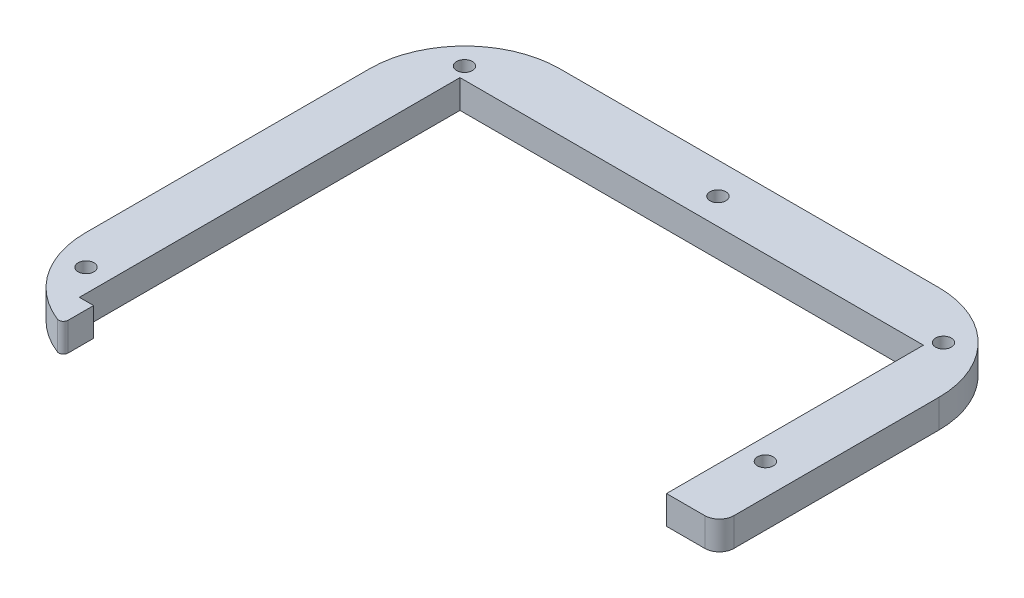
from build123d import *

# Parameters (mm, degrees)
BOSS_EXTRUDE1_DEPTH    = 6
CUT_EXTRUDE1_DEPTH     = 79.33262411
SKETCH3_W              = 25
SKETCH3_H              = 31.620571099
CUT_EXTRUDE2_DEPTH     = 79.33262411
FILLET1_R              = 3
SKETCH4_R              = 1.75
CUT_EXTRUDE3_DEPTH     = 79.33262411
MOVE_FACE1_OUTLINE_R   = 1.75
MOVE_FACE1_OUTLINE_R_2 = 1.67
MOVE_FACE1_DEPTH       = 6
FILLET2_R              = 1


# Read off the part's stored shape, not the designer's step: Move Face1
with BuildPart() as part:
    # Sketch1 → Boss-Extrude1 (new body)
    with BuildSketch(Plane(origin=(0, 0, 0), x_dir=(1, 0, 0), z_dir=(0, 1, 0))):
        with BuildLine():
            Line((-60, 30), (-60, -30))
            ThreePointArc((-60, -30), (-54.142135624, -44.142135624), (-40, -50))
            Line((-40, -50), (40, -50))
            ThreePointArc((40, -50), (54.142135624, -44.142135624), (60, -30))
            Line((60, -30), (60, 30))
            ThreePointArc((60, 30), (54.142135624, 44.142135624), (40, 50))
            Line((40, 50), (-40, 50))
            ThreePointArc((-40, 50), (-54.142135624, 44.142135624), (-60, 30))
        make_face()
    extrude(amount=BOSS_EXTRUDE1_DEPTH)

    # Sketch2 → Cut-Extrude1 (cut, through all)
    with BuildSketch(Plane(origin=(0, 6, 0), x_dir=(1, 0, 0), z_dir=(0, 1, 0))):
        Polygon((-49, 38), (49, 38), (49, -50), (-46, -50), (-46, -42.5), (-49, -42.5), align=None)
    extrude(amount=-CUT_EXTRUDE1_DEPTH, mode=Mode.SUBTRACT)

    # Sketch3 → Cut-Extrude2 (cut, through all)
    with BuildSketch(Plane(origin=(0, 6, 0), x_dir=(1, 0, 0), z_dir=(0, 1, 0))):
        with Locations((61.5, -32.05028555)):
            Rectangle(SKETCH3_W, SKETCH3_H)
    extrude(amount=-CUT_EXTRUDE2_DEPTH, mode=Mode.SUBTRACT)

    # Fillet1
    fillet1_edges = [part.edges().sort_by_distance(p)[0] for p in [
        (60, 3, 16.24),
    ]]
    fillet(fillet1_edges, radius=FILLET1_R)

    # Sketch4 → Cut-Extrude3 (cut, through all)
    with BuildSketch(Plane(origin=(0, 6, 0), x_dir=(1, 0, 0), z_dir=(0, 1, 0))):
        with Locations(Location((53.475, 0, 0), (0, 0, 270))):
            Circle(SKETCH4_R)
        with Locations(Location((-53.709292606, -36.227375296, 0), (0, 0, 270))):
            Circle(SKETCH4_R)
        with Locations(Location((0, 43.45, 0), (0, 0, 270))):
            Circle(SKETCH4_R)
        with Locations(Location((50.558556763, 40.508556763, 0), (0, 0, 270))):
            Circle(SKETCH4_R)
        with Locations(Location((-50.558556763, 40.508556763, 0), (0, 0, 90))):
            Circle(SKETCH4_R)
    extrude(amount=-CUT_EXTRUDE3_DEPTH, mode=Mode.SUBTRACT)

    # Move Face1 outline → Move Face1 (add)
    # profile 1 of 6: a face of its own
    with BuildSketch(Plane(origin=(0, 0, 0), x_dir=(1, 0, 0), z_dir=(0, 1, 0))):
        with BuildLine():
            ThreePointArc((-40, 50.08), (-54.198704166, 44.198704166), (-60.08, 30))
            Line((-60.08, 30), (-60.08, -30))
            ThreePointArc((-60.08, -30), (-56.156732343, -41.923355232), (-45.92, -49.187495928))
            Line((-45.92, -49.187495928), (-45.92, -42.42))
            Line((-45.92, -42.42), (-48.92, -42.42))
            Line((-48.92, -42.42), (-48.92, 37.92))
            Line((-48.92, 37.92), (48.92, 37.92))
            Line((48.92, 37.92), (48.92, -16.32))
            Line((48.92, -16.32), (57, -16.32))
            ThreePointArc((57, -16.32), (59.177888886, -15.417888886), (60.08, -13.24))
            Line((60.08, -13.24), (60.08, 30))
            ThreePointArc((60.08, 30), (54.198704166, 44.198704166), (40, 50.08))
            Line((40, 50.08), (-40, 50.08))
        make_face()
        with BuildLine():
            Line((-60, -30), (-60, 30))
            ThreePointArc((-60, 30), (-54.142135624, 44.142135624), (-40, 50))
            Line((-40, 50), (40, 50))
            ThreePointArc((40, 50), (54.142135624, 44.142135624), (60, 30))
            Line((60, 30), (60, -13.24))
            ThreePointArc((60, -13.24), (59.121320344, -15.361320344), (57, -16.24))
            Line((57, -16.24), (49, -16.24))
            Line((49, -16.24), (49, 38))
            Line((49, 38), (-49, 38))
            Line((-49, 38), (-49, -42.5))
            Line((-49, -42.5), (-46, -42.5))
            Line((-46, -42.5), (-46, -49.078784028))
            ThreePointArc((-46, -49.078784028), (-56.124515497, -41.832159566), (-60, -30))
        make_face(mode=Mode.SUBTRACT)
    # profile 2 of 6: a face of its own
    with BuildSketch(Plane(origin=(0, 0, 0), x_dir=(1, 0, 0), z_dir=(0, 1, 0))):
        with Locations((53.475, 0)):
            Circle(MOVE_FACE1_OUTLINE_R)
        with Locations((53.475, 0)):
            Circle(MOVE_FACE1_OUTLINE_R_2, mode=Mode.SUBTRACT)
    # profile 3 of 6: a face of its own
    with BuildSketch(Plane(origin=(0, 0, 0), x_dir=(1, 0, 0), z_dir=(0, 1, 0))):
        with Locations((0, 43.45)):
            Circle(MOVE_FACE1_OUTLINE_R)
        with Locations((0, 43.45)):
            Circle(MOVE_FACE1_OUTLINE_R_2, mode=Mode.SUBTRACT)
    # profile 4 of 6: a face of its own
    with BuildSketch(Plane(origin=(0, 0, 0), x_dir=(1, 0, 0), z_dir=(0, 1, 0))):
        with Locations((50.558556763, 40.508556763)):
            Circle(MOVE_FACE1_OUTLINE_R)
        with Locations((50.558556763, 40.508556763)):
            Circle(MOVE_FACE1_OUTLINE_R_2, mode=Mode.SUBTRACT)
    # profile 5 of 6: a face of its own
    with BuildSketch(Plane(origin=(0, 0, 0), x_dir=(1, 0, 0), z_dir=(0, 1, 0))):
        with Locations((-50.558556763, 40.508556763)):
            Circle(MOVE_FACE1_OUTLINE_R)
        with Locations((-50.558556763, 40.508556763)):
            Circle(MOVE_FACE1_OUTLINE_R_2, mode=Mode.SUBTRACT)
    # profile 6 of 6: a face of its own
    with BuildSketch(Plane(origin=(0, 0, 0), x_dir=(1, 0, 0), z_dir=(0, 1, 0))):
        with Locations((-53.709292606, -36.227375296)):
            Circle(MOVE_FACE1_OUTLINE_R)
        with Locations((-53.709292606, -36.227375296)):
            Circle(MOVE_FACE1_OUTLINE_R_2, mode=Mode.SUBTRACT)
    extrude(amount=MOVE_FACE1_DEPTH)

    # Fillet2
    fillet2_edges = [part.edges().sort_by_distance(p)[0] for p in [
        (-45.92, 3, 49.187495928),
    ]]
    fillet(fillet2_edges, radius=FILLET2_R)


solid = part.part
